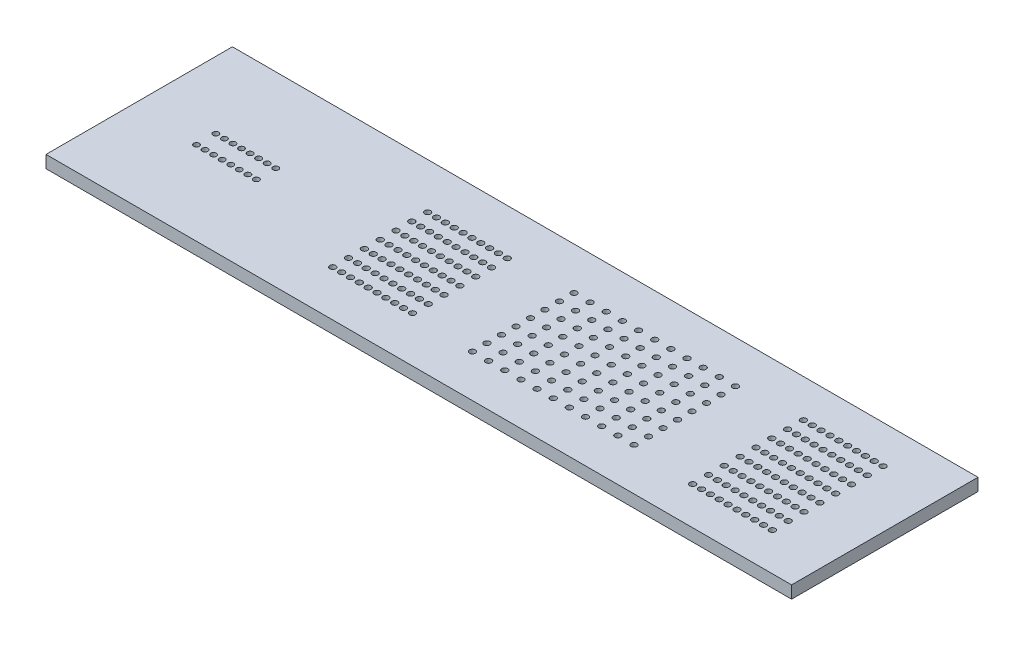
from build123d import *

# Parameters (mm, degrees)
ESQUISSE2_W                     = 120
ESQUISSE2_H                     = 30
BOSS_EXTRU_1_DEPTH              = 2
ENL_V_MAT_EXTRU_3_REACH         = 63.879
ESQUISSE8_R                     = 0.45
R_P_TITION_LIN_AIRE4_COUNT      = 8
R_P_TITION_LIN_AIRE4_PITCH      = 1.377
R_P_TITION_LIN_AIRE4_COUNT_DIR2 = 2
R_P_TITION_LIN_AIRE4_PITCH_DIR2 = 3.111
ENL_V_MAT_EXTRU_4_REACH         = 63.879
ESQUISSE10_R                    = 0.475
R_P_TITION_LIN_AIRE5_COUNT      = 10
R_P_TITION_LIN_AIRE5_PITCH      = 1.425
R_P_TITION_LIN_AIRE5_COUNT_DIR2 = 7
R_P_TITION_LIN_AIRE5_PITCH_DIR2 = 2.545
ENL_V_MAT_EXTRU_5_REACH         = 63.879
ESQUISSE12_R                    = 0.475
R_P_TITION_LIN_AIRE6_COUNT      = 11
R_P_TITION_LIN_AIRE6_PITCH      = 2.6
R_P_TITION_LIN_AIRE6_COUNT_DIR2 = 8
R_P_TITION_LIN_AIRE6_PITCH_DIR2 = 2.333
ENL_V_MAT_EXTRU_6_REACH         = 63.879
ESQUISSE14_R                    = 0.475
R_P_TITION_LIN_AIRE7_COUNT      = 10
R_P_TITION_LIN_AIRE7_PITCH      = 1.425
R_P_TITION_LIN_AIRE7_COUNT_DIR2 = 8
R_P_TITION_LIN_AIRE7_PITCH_DIR2 = 2.545


with BuildPart() as part:
    # Esquisse2 → Boss.-Extru.1 (new body)
    with BuildSketch(Plane(origin=(0, 0, 0), x_dir=(1, 0, 0), z_dir=(0, 1, 0))):
        Rectangle(ESQUISSE2_W, ESQUISSE2_H)
    extrude(amount=BOSS_EXTRU_1_DEPTH)

    # Esquisse8 → Enlèv. mat.-Extru.3 (cut, up to next)
    with BuildSketch(Plane(origin=(0, 2, 0), x_dir=(1, 0, 0), z_dir=(0, 1, 0)), mode=Mode.PRIVATE) as enl_v_mat_extru_3_sk1:
        with Locations((-49.2195, 1.5555)):
            Circle(ESQUISSE8_R)
    enl_v_mat_extru_3_tool1 = extrude(enl_v_mat_extru_3_sk1.sketch, amount=-ENL_V_MAT_EXTRU_3_REACH, mode=Mode.PRIVATE) & part.part
    enl_v_mat_extru_3 = enl_v_mat_extru_3_tool1.solids().sort_by_distance((-49.2195, 2, -1.5555))[0]
    add(enl_v_mat_extru_3, mode=Mode.SUBTRACT)

    # Répétition linéaire4: Enl_v. mat.-Extru.3 8 × 2
    with Locations(*[(i * R_P_TITION_LIN_AIRE4_PITCH, 0, j * R_P_TITION_LIN_AIRE4_PITCH_DIR2) for i in range(R_P_TITION_LIN_AIRE4_COUNT) for j in range(R_P_TITION_LIN_AIRE4_COUNT_DIR2) if (i, j) != (0, 0)]):
        add(enl_v_mat_extru_3, mode=Mode.SUBTRACT)

    # Esquisse10 → Enlèv. mat.-Extru.4 (cut, up to next)
    with BuildSketch(Plane(origin=(0, 2, 0), x_dir=(1, 0, 0), z_dir=(0, 1, 0)), mode=Mode.PRIVATE) as enl_v_mat_extru_4_sk1:
        with Locations((-21.2125, 7.635)):
            Circle(ESQUISSE10_R)
    enl_v_mat_extru_4_tool1 = extrude(enl_v_mat_extru_4_sk1.sketch, amount=-ENL_V_MAT_EXTRU_4_REACH, mode=Mode.PRIVATE) & part.part
    enl_v_mat_extru_4 = enl_v_mat_extru_4_tool1.solids().sort_by_distance((-21.2125, 2, -7.635))[0]
    add(enl_v_mat_extru_4, mode=Mode.SUBTRACT)

    # Répétition linéaire5: Enl_v. mat.-Extru.4 10 × 7
    with Locations(*[(i * R_P_TITION_LIN_AIRE5_PITCH, 0, j * R_P_TITION_LIN_AIRE5_PITCH_DIR2) for i in range(R_P_TITION_LIN_AIRE5_COUNT) for j in range(R_P_TITION_LIN_AIRE5_COUNT_DIR2) if (i, j) != (0, 0)]):
        add(enl_v_mat_extru_4, mode=Mode.SUBTRACT)

    # Esquisse12 → Enlèv. mat.-Extru.5 (cut, up to next)
    with BuildSketch(Plane(origin=(0, 2, 0), x_dir=(1, 0, 0), z_dir=(0, 1, 0)), mode=Mode.PRIVATE) as enl_v_mat_extru_5_sk1:
        with Locations((1.8, 8.1655)):
            Circle(ESQUISSE12_R)
    enl_v_mat_extru_5_tool1 = extrude(enl_v_mat_extru_5_sk1.sketch, amount=-ENL_V_MAT_EXTRU_5_REACH, mode=Mode.PRIVATE) & part.part
    enl_v_mat_extru_5 = enl_v_mat_extru_5_tool1.solids().sort_by_distance((1.8, 2, -8.1655))[0]
    add(enl_v_mat_extru_5, mode=Mode.SUBTRACT)

    # Répétition linéaire6: Enl_v. mat.-Extru.5 11 × 8
    with Locations(*[(i * R_P_TITION_LIN_AIRE6_PITCH, 0, j * R_P_TITION_LIN_AIRE6_PITCH_DIR2) for i in range(R_P_TITION_LIN_AIRE6_COUNT) for j in range(R_P_TITION_LIN_AIRE6_COUNT_DIR2) if (i, j) != (0, 0)]):
        add(enl_v_mat_extru_5, mode=Mode.SUBTRACT)

    # Esquisse14 → Enlèv. mat.-Extru.6 (cut, up to next)
    with BuildSketch(Plane(origin=(0, 2, 0), x_dir=(1, 0, 0), z_dir=(0, 1, 0)), mode=Mode.PRIVATE) as enl_v_mat_extru_6_sk1:
        with Locations((37.9875, 8.9075)):
            Circle(ESQUISSE14_R)
    enl_v_mat_extru_6_tool1 = extrude(enl_v_mat_extru_6_sk1.sketch, amount=-ENL_V_MAT_EXTRU_6_REACH, mode=Mode.PRIVATE) & part.part
    enl_v_mat_extru_6 = enl_v_mat_extru_6_tool1.solids().sort_by_distance((37.9875, 2, -8.9075))[0]
    add(enl_v_mat_extru_6, mode=Mode.SUBTRACT)

    # Répétition linéaire7: Enl_v. mat.-Extru.6 10 × 8
    with Locations(*[(i * R_P_TITION_LIN_AIRE7_PITCH, 0, j * R_P_TITION_LIN_AIRE7_PITCH_DIR2) for i in range(R_P_TITION_LIN_AIRE7_COUNT) for j in range(R_P_TITION_LIN_AIRE7_COUNT_DIR2) if (i, j) != (0, 0)]):
        add(enl_v_mat_extru_6, mode=Mode.SUBTRACT)


solid = part.part
